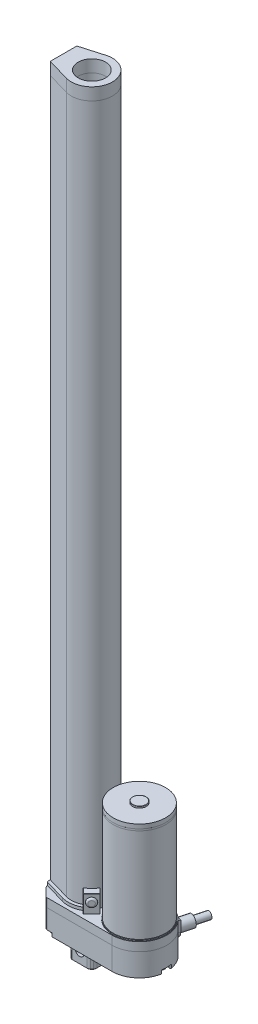
from build123d import *

# Parameters (mm, degrees)
BOSS_EXTRUDE1_DEPTH    = 6.35
SKETCH6_R              = 19.431
BOSS_EXTRUDE4_DEPTH    = 0.762
SKETCH7_R              = 19.05
BOSS_EXTRUDE5_DEPTH    = 68.326
FILLET6_R              = 5.08
FILLET7_R              = 1.905
BOSS_EXTRUDE15_DEPTH   = 6.35
SKETCH24_R             = 4.064
BOSS_EXTRUDE16_DEPTH   = 10.16
SKETCH25_R             = 2.54
BOSS_EXTRUDE17_DEPTH   = 10.16
BOSS_EXTRUDE19_DEPTH   = 16.51
FILLET13_R             = 1.905
FILLET14_R             = 5.08
BOSS_EXTRUDE20_DEPTH   = 18.796
CHAMFER1_SIZE          = 2.54
FILLET15_R             = 2.54
CHAMFER2_SIZE          = 0.762
SKETCH27_R             = 3.175
CUT_EXTRUDE3_DEPTH     = 19.05
SKETCH28_R             = 19.05
BOSS_EXTRUDE22_DEPTH   = 1.27
SKETCH29_R             = 19.05
BOSS_EXTRUDE24_DEPTH   = 3.048
BOSS_EXTRUDE25_START   = 4.318
SKETCH8_R              = 4.953
BOSS_EXTRUDE25_DEPTH   = 1.27
FILLET16_R             = 0.2286
BOSS_EXTRUDE26_DEPTH   = 508.381
SKETCH32_R             = 9.9695
BOSS_EXTRUDE27_DEPTH   = 8.89
BOSS_EXTRUDE30_DEPTH   = 2.159
BOSS_EXTRUDE31_DEPTH   = 2.159
BOSS_EXTRUDE33_DEPTH   = 12.7
BOSS_EXTRUDE33_2_DEPTH = 12.7
FILLET17_R             = 0.2286
FILLET18_R             = 0.2286
SKETCH43_R             = 3.175
BOSS_EXTRUDE34_DEPTH   = 1.27
FILLET19_R             = 1.27
SKETCH44_R             = 3.175
BOSS_EXTRUDE35_DEPTH   = 1.27
FILLET20_R             = 1.27
CUT_EXTRUDE5_START     = -2.54
CUT_EXTRUDE5_DEPTH     = 2.54
CUT_EXTRUDE6_START     = -2.54
CUT_EXTRUDE6_DEPTH     = 2.54
SKETCH47_R             = 2.54
BOSS_EXTRUDE36_DEPTH   = 2.54
BOSS_EXTRUDE36_2_DEPTH = 2.54
BOSS_EXTRUDE36_3_DEPTH = 2.54
FILLET22_R             = 1.524
FILLET23_R             = 1.524
SKETCH48_R             = 3.81
BOSS_EXTRUDE37_DEPTH   = 1.524
FILLET24_R             = 1.524
FILLET25_R             = 1.524
SKETCH49_R             = 3.81
CUT_EXTRUDE7_DEPTH     = 2.54
SKETCH50_R             = 3.556
BOSS_EXTRUDE39_DEPTH   = 2.54
SKETCH33_R             = 10.033
CUT_EXTRUDE8_DEPTH     = 488.95
SCALE1_SCALE           = 0.25


with BuildPart() as part:
    # Sketch1 → Boss-Extrude1 (new body)
    with BuildSketch(Plane(origin=(0, 0, 0), x_dir=(1, 0, 0), z_dir=(0, 1, 0))):
        with BuildLine():
            Line((0, 32.639), (7.239, 39.878))
            Line((7.239, 39.878), (55.118, 39.878))
            ThreePointArc((55.118, 39.878), (75.057, 19.939), (55.118, 0))
            Line((55.118, 0), (7.239, 0))
            Line((7.239, 0), (0, 7.239))
            Line((0, 7.239), (0, 32.639))
        make_face()
    extrude(amount=BOSS_EXTRUDE1_DEPTH)

    # Fillet6
    fillet6_edges = [part.edges().sort_by_distance(p)[0] for p in [
        (0, 3.175, -7.239),
        (0, 3.175, -32.639),
    ]]
    fillet(fillet6_edges, radius=FILLET6_R)

    # Fillet7
    fillet7_edges = [part.edges().sort_by_distance(p)[0] for p in [
        (7.239, 3.175, 0),
        (7.239, 3.175, -39.878),
    ]]
    fillet(fillet7_edges, radius=FILLET7_R)


with BuildPart() as body_2:
    # Sketch6 → Boss-Extrude4 (new body)
    with BuildSketch(Plane(origin=(0, 6.35, 0), x_dir=(1, 0, 0), z_dir=(0, 1, 0))):
        with Locations(Location((55.118, 19.939, 0), (0, 0, 90))):
            Circle(SKETCH6_R)
    extrude(amount=BOSS_EXTRUDE4_DEPTH)


with BuildPart() as body_3:
    # Sketch7 → Boss-Extrude5 (new body)
    with BuildSketch(Plane(origin=(0, 7.112, 0), x_dir=(1, 0, 0), z_dir=(0, 1, 0))):
        with Locations(Location((55.118, 19.939, 0), (0, 0, 270))):
            Circle(SKETCH7_R)
    extrude(amount=BOSS_EXTRUDE5_DEPTH)


with BuildPart() as body_4:
    # Sketch23 → Boss-Extrude15 (new body)
    with BuildSketch(Plane(origin=(12.522748088, 0, -46.735532116), x_dir=(0, -1, 0), z_dir=(0.25881904510252135, 0, -0.9659258262890681))):
        with BuildLine():
            Line((-2.032, -53.883866243), (5.588, -53.883866243))
            ThreePointArc((5.588, -53.883866243), (11.303, -48.168866243), (5.588, -42.453866243))
            Line((5.588, -42.453866243), (-2.032, -42.453866243))
            Line((-2.032, -42.453866243), (-2.032, -53.883866243))
        make_face()
    extrude(amount=BOSS_EXTRUDE15_DEPTH)

    # Sketch24 → Boss-Extrude16 (add)
    with BuildSketch(Plane(origin=(14.166249025, 0, -52.869161113), x_dir=(-0.9659258262890682, 0, -0.25881904510252135), z_dir=(0.2588190451025213, 0, -0.9659258262890681))):
        with Locations((-48.168866243, -5.588)):
            Circle(SKETCH24_R)
    extrude(amount=BOSS_EXTRUDE16_DEPTH)

    # Sketch25 → Boss-Extrude17 (add)
    with BuildSketch(Plane(origin=(16.795850523, 0, -62.682967508), x_dir=(-0.9659258262890681, 0, -0.25881904510252135), z_dir=(0.25881904510252135, 0, -0.9659258262890681))):
        with Locations((-48.168866243, -5.588)):
            Circle(SKETCH25_R)
    extrude(amount=BOSS_EXTRUDE17_DEPTH)


with BuildPart() as body_5:
    # Sketch1<3> → Boss-Extrude19 (new body)
    with BuildSketch(Plane(origin=(0, 0, 0), x_dir=(1, 0, 0), z_dir=(0, 1, 0))):
        with BuildLine():
            Line((0, 32.639), (7.239, 39.878))
            Line((7.239, 39.878), (55.118, 39.878))
            ThreePointArc((55.118, 39.878), (75.057, 19.939), (55.118, 0))
            Line((55.118, 0), (7.239, 0))
            Line((7.239, 0), (0, 7.239))
            Line((0, 7.239), (0, 32.639))
        make_face()
    extrude(amount=-BOSS_EXTRUDE19_DEPTH)

    # Fillet13
    fillet13_edges = [body_5.edges().sort_by_distance(p)[0] for p in [
        (7.239, -8.255, 0),
        (7.239, -8.255, -39.878),
    ]]
    fillet(fillet13_edges, radius=FILLET13_R)

    # Fillet14
    fillet14_edges = [body_5.edges().sort_by_distance(p)[0] for p in [
        (0, -8.255, -7.239),
        (0, -8.255, -32.639),
    ]]
    fillet(fillet14_edges, radius=FILLET14_R)

    # Sketch45 → Cut-Extrude5 (cut)
    with BuildSketch(Plane.XZ.offset(16.51).offset(CUT_EXTRUDE5_START)):
        with BuildLine():
            ThreePointArc((5.044290367, -35.978344089), (4.718699387, -36.549691761), (4.084467985, -36.723467985))
            Line((4.084467985, -36.723467985), (6.681038418, -39.320038418))
            ThreePointArc((6.681038418, -39.320038418), (7.299064898, -39.732990509), (8.028076836, -39.878))
            Line((8.028076836, -39.878), (11.393838428, -39.878))
            ThreePointArc((11.393838428, -39.878), (11.138454644, -39.419455597), (11.282110896, -38.914632134))
            ThreePointArc((11.282110896, -38.914632134), (10.476958507, -32.531164357), (5.044290367, -35.978344089))
        make_face()
        with BuildLine():
            ThreePointArc((11.282110896, -0.963367866), (11.138454644, -0.458544403), (11.393838428, 0))
            Line((11.393838428, 0), (8.028076836, 0))
            ThreePointArc((8.028076836, 0), (7.299064898, -0.145009491), (6.681038418, -0.557961582))
            Line((6.681038418, -0.557961582), (4.084467985, -3.154532015))
            ThreePointArc((4.084467985, -3.154532015), (4.718699387, -3.328308239), (5.044290367, -3.899655911))
            ThreePointArc((5.044290367, -3.899655911), (10.476958507, -7.346835643), (11.282110896, -0.963367866))
        make_face()
    extrude(amount=CUT_EXTRUDE5_DEPTH, mode=Mode.SUBTRACT)

    # Sketch45<3> → Cut-Extrude6 (cut)
    with BuildSketch(Plane.XZ.offset(16.51).offset(CUT_EXTRUDE6_START)):
        with BuildLine():
            Line((4.084467985, -36.723467985), (6.681038418, -39.320038418))
            ThreePointArc((6.681038418, -39.320038418), (7.299064898, -39.732990509), (8.028076836, -39.878))
            Line((8.028076836, -39.878), (11.393838428, -39.878))
            ThreePointArc((11.393838428, -39.878), (11.138454644, -39.419455597), (11.282110896, -38.914632134))
            ThreePointArc((11.282110896, -38.914632134), (10.476958507, -32.531164357), (5.044290367, -35.978344089))
            ThreePointArc((5.044290367, -35.978344089), (4.718699387, -36.549691761), (4.084467985, -36.723467985))
        make_face()
        with BuildLine():
            Line((11.393838428, 0), (8.028076836, 0))
            ThreePointArc((8.028076836, 0), (7.299064898, -0.145009491), (6.681038418, -0.557961582))
            Line((6.681038418, -0.557961582), (4.084467985, -3.154532015))
            ThreePointArc((4.084467985, -3.154532015), (4.718699387, -3.328308239), (5.044290367, -3.899655911))
            ThreePointArc((5.044290367, -3.899655911), (10.476958507, -7.346835643), (11.282110896, -0.963367866))
            ThreePointArc((11.282110896, -0.963367866), (11.138454644, -0.458544403), (11.393838428, 0))
        make_face()
        with BuildLine():
            ThreePointArc((73.662109712, -16.992248385), (67.437, -19.939), (73.662109712, -22.885751615))
            ThreePointArc((73.662109712, -22.885751615), (74.341584064, -23.041280193), (74.712069674, -23.631716426))
            ThreePointArc((74.712069674, -23.631716426), (75.057, -19.939), (74.712069674, -16.246283574))
            ThreePointArc((74.712069674, -16.246283574), (74.341584064, -16.836719807), (73.662109712, -16.992248385))
        make_face()
    extrude(amount=CUT_EXTRUDE6_DEPTH, mode=Mode.SUBTRACT)


with BuildPart() as body_6:
    # Sketch26 → Boss-Extrude20 (new body)
    with BuildSketch(Plane(origin=(0, -16.51, 0), x_dir=(-1, 0, 0), z_dir=(0, -1, 0))):
        Polygon((-20.574, 28.829), (-11.684, 28.829), (-11.684, 11.049), (-29.464, 11.049), (-29.464, 28.829), align=None)
    extrude(amount=BOSS_EXTRUDE20_DEPTH)

    # Chamfer1
    chamfer1_edges = [body_6.edges().sort_by_distance(p)[0] for p in [
        (11.684, -25.908, -11.049),
        (29.464, -25.908, -11.049),
        (29.464, -25.908, -28.829),
        (11.684, -25.908, -28.829),
    ]]
    chamfer(chamfer1_edges, length=CHAMFER1_SIZE)

    # Fillet15
    fillet15_edges = [body_6.edges().sort_by_distance(p)[0] for p in [
        (29.464, -25.908, -13.589),
        (29.464, -25.908, -26.289),
        (14.224, -25.908, -28.829),
        (26.924, -25.908, -28.829),
        (14.224, -25.908, -11.049),
        (26.924, -25.908, -11.049),
        (11.684, -25.908, -26.289),
        (11.684, -25.908, -13.589),
    ]]
    fillet(fillet15_edges, radius=FILLET15_R)

    # Chamfer2
    chamfer2_edges = [body_6.edges().sort_by_distance(p)[0] for p in [
        (11.684, -35.306, -19.939),
        (12.954, -35.306, -12.319),
        (20.574, -35.306, -28.829),
        (28.194, -35.306, -27.559),
        (29.464, -35.306, -19.939),
        (28.194, -35.306, -12.319),
        (20.574, -35.306, -11.049),
        (12.954, -35.306, -27.559),
        (14.30408653, -35.306, -28.635654013),
        (11.877345987, -35.306, -26.20891347),
        (26.84391347, -35.306, -28.635654013),
        (29.270654013, -35.306, -26.20891347),
        (29.270654013, -35.306, -13.66908653),
        (26.84391347, -35.306, -11.242345987),
        (14.30408653, -35.306, -11.242345987),
        (11.877345987, -35.306, -13.66908653),
    ]]
    chamfer(chamfer2_edges, length=CHAMFER2_SIZE)

    # Sketch27 → Cut-Extrude3 (cut)
    with BuildSketch(Plane.XY.offset(-11.049)):
        with Locations((20.574, -26.67)):
            Circle(SKETCH27_R)
    extrude(amount=-CUT_EXTRUDE3_DEPTH, mode=Mode.SUBTRACT)


with BuildPart() as body_7:
    # Sketch28 → Boss-Extrude22 (new body)
    with BuildSketch(Plane(origin=(0, 75.438, 0), x_dir=(1, 0, 0), z_dir=(0, 1, 0))):
        with Locations(Location((55.118, 19.939, 0), (0, 0, 270))):
            Circle(SKETCH28_R)
    extrude(amount=BOSS_EXTRUDE22_DEPTH)


with BuildPart() as body_8:
    # Sketch29 → Boss-Extrude24 (new body)
    with BuildSketch(Plane(origin=(0, 76.708, 0), x_dir=(1, 0, 0), z_dir=(0, 1, 0))):
        with Locations(Location((55.118, 19.939, 0), (0, 0, 270))):
            Circle(SKETCH29_R)
    extrude(amount=BOSS_EXTRUDE24_DEPTH)

    # Sketch8 → Boss-Extrude25 (add)
    with BuildSketch(Plane(origin=(0, 75.438, 0), x_dir=(1, 0, 0), z_dir=(0, 1, 0)).offset(BOSS_EXTRUDE25_START)):
        with Locations(Location((55.118, 19.939, 0), (0, 0, 270))):
            Circle(SKETCH8_R)
    extrude(amount=BOSS_EXTRUDE25_DEPTH)

    # Fillet16
    fillet16_edges = [body_8.edges().sort_by_distance(p)[0] for p in [
        (55.118, 81.026, -24.892),
    ]]
    fillet(fillet16_edges, radius=FILLET16_R)


with BuildPart() as body_9:
    # Sketch15 → Boss-Extrude26 (new body)
    with BuildSketch(Plane(origin=(0, 6.35, 0), x_dir=(1, 0, 0), z_dir=(0, 1, 0))):
        with BuildLine():
            Line((0, 19.939), (0, 10.286870396))
            Line((0, 10.286870396), (16.411980417, 5.54225678))
            ThreePointArc((16.411980417, 5.54225678), (35.560281138, 19.939054609), (16.411875495, 34.335712887))
            Line((16.411875495, 34.335712887), (0, 29.591))
            Line((0, 29.591), (0, 19.939))
        make_face()
    extrude(amount=BOSS_EXTRUDE26_DEPTH)

    # Sketch48 → Boss-Extrude37 (add)
    with BuildSketch(Plane.ZY):
        with Locations(Location((-19.939, 12.7, 0), (0, 0, 180))):
            Circle(SKETCH48_R)
    extrude(amount=BOSS_EXTRUDE37_DEPTH)

    # Fillet24
    fillet24_edges = [body_9.edges().sort_by_distance(p)[0] for p in [
        (-1.524, 12.7, -16.129),
    ]]
    fillet(fillet24_edges, radius=FILLET24_R - 0.0001)  # a hair under: the kernel refuses the full size

    # Sketch49 → Cut-Extrude7 (cut)
    with BuildSketch(Plane.ZY):
        with Locations((-19.938935198, 509.778)):
            Circle(SKETCH49_R)
    extrude(amount=-CUT_EXTRUDE7_DEPTH, mode=Mode.SUBTRACT)

    # Sketch50 → Boss-Extrude39 (add)
    with BuildSketch(Plane.ZY.offset(-2.54)):
        with Locations((-19.938935198, 509.778)):
            Circle(SKETCH50_R)
    extrude(amount=BOSS_EXTRUDE39_DEPTH)

    # Sketch33 → Cut-Extrude8 (cut)
    with BuildSketch(Plane(origin=(0, 523.621, 0), x_dir=(1, 0, 0), z_dir=(0, 1, 0))):
        with Locations(Location((20.574, 19.939, 0), (0, 0, 270))):
            Circle(SKETCH33_R)
    extrude(amount=-CUT_EXTRUDE8_DEPTH, mode=Mode.SUBTRACT)


with BuildPart() as body_10:
    # Sketch32 → Boss-Extrude27 (new body)
    with BuildSketch(Plane(origin=(0, 514.731, 0), x_dir=(1, 0, 0), z_dir=(0, 1, 0))):
        with BuildLine():
            Line((0, 10.286870396), (0, 29.591))
            Line((0, 29.591), (16.411875495, 34.335712887))
            ThreePointArc((16.411875495, 34.335712887), (35.560281138, 19.939054609), (16.411980417, 5.54225678))
            Line((16.411980417, 5.54225678), (0, 10.286870396))
        make_face()
        with Locations(Location((20.574, 19.939, 0), (0, 0, 270))):
            Circle(SKETCH32_R, mode=Mode.SUBTRACT)
    extrude(amount=BOSS_EXTRUDE27_DEPTH)


with BuildPart() as body_11:
    # Sketch41 → Boss-Extrude30 (new body)
    with BuildSketch(Plane(origin=(0, 6.35, 0), x_dir=(1, 0, 0), z_dir=(0, 1, 0))):
        with BuildLine():
            Line((0, 29.591), (16.411875495, 34.335712887))
            ThreePointArc((16.411875495, 34.335712887), (22.021175201, 34.855243035), (27.425990452, 33.267122493))
            Line((27.425990452, 33.267122493), (29.11221422, 34.953346261))
            ThreePointArc((29.11221422, 34.953346261), (22.604273469, 37.091541659), (15.776987058, 36.531780434))
            Line((15.776987058, 36.531780434), (0.2736806, 32.049737053))
            Line((0.2736806, 32.049737053), (0, 30.534795103))
            Line((0, 30.534795103), (0, 29.591))
        make_face()
    extrude(amount=BOSS_EXTRUDE30_DEPTH)


with BuildPart() as body_12:
    # Sketch41<11> → Boss-Extrude31 (new body)
    with BuildSketch(Plane(origin=(0, 6.35, 0), x_dir=(1, 0, 0), z_dir=(0, 1, 0))):
        with BuildLine():
            Line((16.411875495, 5.542157508), (0, 10.286870396))
            Line((0, 10.286870396), (0, 9.343204897))
            Line((0, 9.343204897), (0, 9.343075292))
            Line((0, 9.343075292), (0.2736806, 7.828133343))
            Line((0.2736806, 7.828133343), (15.776987058, 3.346089961))
            ThreePointArc((15.776987058, 3.346089961), (22.604273469, 2.786328737), (29.11221422, 4.924524135))
            Line((29.11221422, 4.924524135), (27.425990452, 6.610747903))
            ThreePointArc((27.425990452, 6.610747903), (22.021175201, 5.02262736), (16.411875495, 5.542157508))
        make_face()
    extrude(amount=BOSS_EXTRUDE31_DEPTH)


with BuildPart() as body_13:
    # Sketch41<12> → Boss-Extrude33 (new body)
    with BuildSketch(Plane(origin=(0, 6.35, 0), x_dir=(1, 0, 0), z_dir=(0, 1, 0))):
        with BuildLine():
            Line((29.11221422, 34.953346261), (27.425990452, 33.267122493))
            ThreePointArc((27.425990452, 33.267122493), (31.070982239, 30.634886416), (33.77116823, 27.039941701))
            Line((33.77116823, 27.039941701), (37.542875801, 30.811649272))
            Line((37.542875801, 30.811649272), (31.256696516, 37.097828557))
            Line((31.256696516, 37.097828557), (29.11221422, 34.953346261))
        make_face()
    extrude(amount=BOSS_EXTRUDE33_DEPTH)

    # Fillet17
    fillet17_edges = [body_13.edges().sort_by_distance(p)[0] for p in [
        (35.657022016, 19.05, -28.925795487),
        (34.399786159, 19.05, -33.954738915),
        (29.341343484, 19.05, -35.182475525),
        (31.256696516, 12.7, -37.097828557),
        (37.542875801, 12.7, -30.811649272),
    ]]
    fillet(fillet17_edges, radius=FILLET17_R)


with BuildPart() as body_14:
    # Sketch41<12> → Boss-Extrude33 2 (new body)
    with BuildSketch(Plane(origin=(0, 6.35, 0), x_dir=(1, 0, 0), z_dir=(0, 1, 0))):
        with BuildLine():
            Line((31.256696516, 2.780041839), (37.542875801, 9.066221123))
            Line((37.542875801, 9.066221123), (33.77116823, 12.837928694))
            ThreePointArc((33.77116823, 12.837928694), (31.070982239, 9.24298398), (27.425990452, 6.610747903))
            Line((27.425990452, 6.610747903), (29.11221422, 4.924524135))
            Line((29.11221422, 4.924524135), (31.256696516, 2.780041839))
        make_face()
    extrude(amount=BOSS_EXTRUDE33_2_DEPTH)

    # Fillet18
    fillet18_edges = [body_14.edges().sort_by_distance(p)[0] for p in [
        (34.399786159, 19.05, -5.923131481),
        (35.657022016, 19.05, -10.952074909),
        (29.341343484, 19.05, -4.695394871),
        (37.542875801, 12.7, -9.066221123),
        (31.256696516, 12.7, -2.780041839),
    ]]
    fillet(fillet18_edges, radius=FILLET18_R)


with BuildPart() as body_15:
    # Sketch43 → Boss-Extrude34 (new body)
    with BuildSketch(Plane(origin=(34.177262537, 0, -34.177262537), x_dir=(-0.7071067811865481, 0, -0.7071067811865469), z_dir=(0.7071067811865469, 0, -0.7071067811865481))):
        with Locations(Location((-0.314695924, 13.7414, 0), (0, 0, 180))):
            Circle(SKETCH43_R)
    extrude(amount=BOSS_EXTRUDE34_DEPTH)

    # Fillet19
    fillet19_edges = [body_15.edges().sort_by_distance(p)[0] for p in [
        (33.052747741, 13.7414, -37.097828557),
    ]]
    fillet(fillet19_edges, radius=FILLET19_R - 0.0001)  # a hair under: the kernel refuses the full size


with BuildPart() as body_16:
    # Sketch44 → Boss-Extrude35 (new body)
    with BuildSketch(Plane(origin=(14.238327339, 0, 14.238327339), x_dir=(0.7071067811865481, 0, -0.7071067811865469), z_dir=(0.7071067811865469, 0, 0.7071067811865481))):
        with Locations(Location((28.5126085, 13.7414, 0), (0, 0, 180))):
            Circle(SKETCH44_R)
    extrude(amount=BOSS_EXTRUDE35_DEPTH)

    # Fillet20
    fillet20_edges = [body_16.edges().sort_by_distance(p)[0] for p in [
        (37.542875801, 13.7414, -7.270169899),
    ]]
    fillet(fillet20_edges, radius=FILLET20_R - 0.0001)  # a hair under: the kernel refuses the full size


with BuildPart() as body_17:
    # Sketch47 → Boss-Extrude36 (new body)
    with BuildSketch(Plane(origin=(0, -13.97, 0), x_dir=(-1, 0, 0), z_dir=(0, -1, 0))):
        with Locations(Location((-8.854290367, 35.978344089, 0), (0, 0, 90))):
            Circle(SKETCH47_R)
    extrude(amount=BOSS_EXTRUDE36_DEPTH)

    # Fillet22
    fillet22_edges = [body_17.edges().sort_by_distance(p)[0] for p in [
        (8.854290367, -16.51, -33.438344089),
    ]]
    fillet(fillet22_edges, radius=FILLET22_R)


with BuildPart() as body_18:
    # Sketch47 → Boss-Extrude36 2 (new body)
    with BuildSketch(Plane(origin=(0, -13.97, 0), x_dir=(-1, 0, 0), z_dir=(0, -1, 0))):
        with Locations(Location((-8.854290367, 3.899655911, 0), (0, 0, 90))):
            Circle(SKETCH47_R)
    extrude(amount=BOSS_EXTRUDE36_2_DEPTH)

    # Fillet23
    fillet23_edges = [body_18.edges().sort_by_distance(p)[0] for p in [
        (8.854290367, -16.51, -1.359655911),
    ]]
    fillet(fillet23_edges, radius=FILLET23_R)


with BuildPart() as body_19:
    # Sketch47 → Boss-Extrude36 3 (new body)
    with BuildSketch(Plane(origin=(0, -13.97, 0), x_dir=(-1, 0, 0), z_dir=(0, -1, 0))):
        with Locations(Location((-71.247, 19.939, 0), (0, 0, 90))):
            Circle(SKETCH47_R)
    extrude(amount=BOSS_EXTRUDE36_3_DEPTH)

    # Fillet25
    fillet25_edges = [body_19.edges().sort_by_distance(p)[0] for p in [
        (71.247, -16.51, -17.399),
    ]]
    fillet(fillet25_edges, radius=FILLET25_R)


with BuildPart() as body_10_1:
    # Scale1: scaled about (0, 0, 0)
    add(body_10.part.scale(SCALE1_SCALE))


with BuildPart() as body_4_1:
    # Scale1: scaled about (0, 0, 0)
    add(body_4.part.scale(SCALE1_SCALE))


with BuildPart() as body_8_1:
    # Scale1: scaled about (0, 0, 0)
    add(body_8.part.scale(SCALE1_SCALE))


with BuildPart() as body_13_1:
    # Scale1: scaled about (0, 0, 0)
    add(body_13.part.scale(SCALE1_SCALE))


with BuildPart() as body_18_1:
    # Scale1: scaled about (0, 0, 0)
    add(body_18.part.scale(SCALE1_SCALE))


with BuildPart() as body_14_1:
    # Scale1: scaled about (0, 0, 0)
    add(body_14.part.scale(SCALE1_SCALE))


with BuildPart() as body_19_1:
    # Scale1: scaled about (0, 0, 0)
    add(body_19.part.scale(SCALE1_SCALE))


with BuildPart() as part_1:
    # Scale1: scaled about (0, 0, 0)
    add(part.part.scale(SCALE1_SCALE))


with BuildPart() as body_5_1:
    # Scale1: scaled about (0, 0, 0)
    add(body_5.part.scale(SCALE1_SCALE))


with BuildPart() as body_3_1:
    # Scale1: scaled about (0, 0, 0)
    add(body_3.part.scale(SCALE1_SCALE))


with BuildPart() as body_15_1:
    # Scale1: scaled about (0, 0, 0)
    add(body_15.part.scale(SCALE1_SCALE))


with BuildPart() as body_2_1:
    # Scale1: scaled about (0, 0, 0)
    add(body_2.part.scale(SCALE1_SCALE))


with BuildPart() as body_6_1:
    # Scale1: scaled about (0, 0, 0)
    add(body_6.part.scale(SCALE1_SCALE))


with BuildPart() as body_11_1:
    # Scale1: scaled about (0, 0, 0)
    add(body_11.part.scale(SCALE1_SCALE))


with BuildPart() as body_16_1:
    # Scale1: scaled about (0, 0, 0)
    add(body_16.part.scale(SCALE1_SCALE))


with BuildPart() as body_9_1:
    # Scale1: scaled about (0, 0, 0)
    add(body_9.part.scale(SCALE1_SCALE))


with BuildPart() as body_12_1:
    # Scale1: scaled about (0, 0, 0)
    add(body_12.part.scale(SCALE1_SCALE))


with BuildPart() as body_17_1:
    # Scale1: scaled about (0, 0, 0)
    add(body_17.part.scale(SCALE1_SCALE))


with BuildPart() as body_7_1:
    # Scale1: scaled about (0, 0, 0)
    add(body_7.part.scale(SCALE1_SCALE))


solid = Compound([body_10_1.part, body_4_1.part, body_8_1.part, body_13_1.part, body_18_1.part, body_14_1.part, body_19_1.part, part_1.part, body_5_1.part, body_3_1.part, body_15_1.part, body_2_1.part, body_6_1.part, body_11_1.part, body_16_1.part, body_9_1.part, body_12_1.part, body_17_1.part, body_7_1.part])
